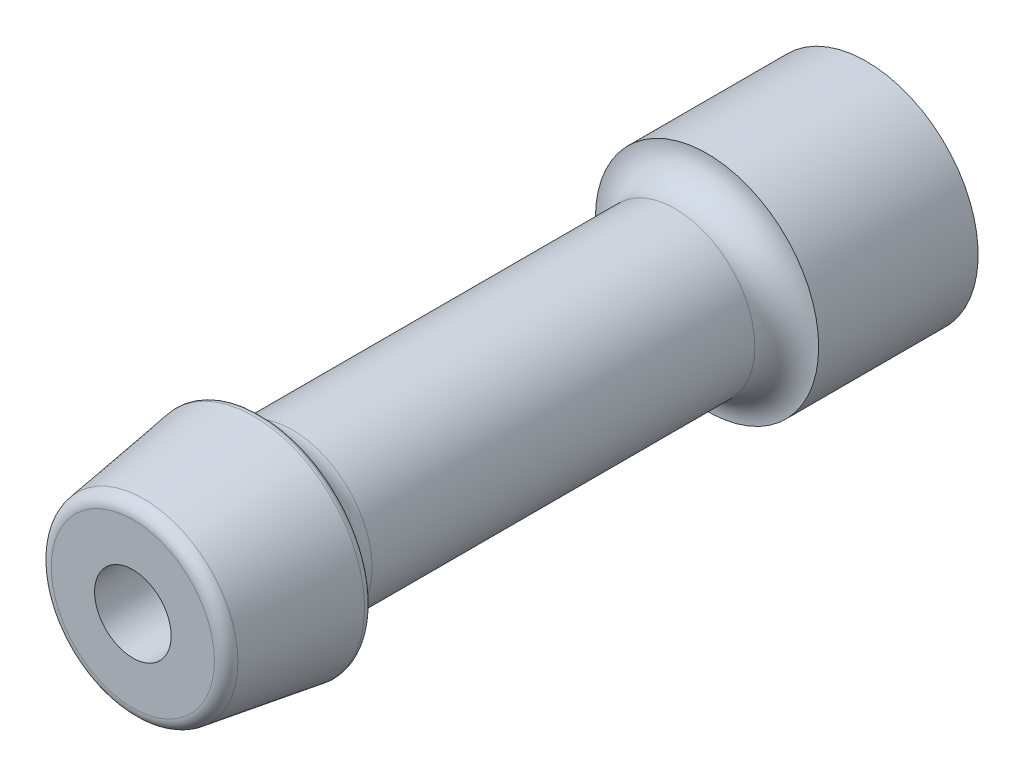
from build123d import *

# Parameters (mm, degrees)
SKETCH1_R           = 4.445
BOSS_EXTRUDE1_DEPTH = 29.21
SKETCH2_R           = 1.524
CUT_EXTRUDE1_START  = -5.08
SKETCH3_R           = 6.35
SKETCH3_R_2         = 3.175
CUT_EXTRUDE1_DEPTH  = 17.78
FILLET1_R           = 1.27
FILLET2_R           = 1.27
CHAMFER1_SIZE       = 5.08
CHAMFER1_SIZE_2     = 0.759211087
FILLET3_R           = 0.254
FILLET4_R           = 0.508


# Some blends are built 0.0001 mm under size
with BuildPart() as part:
    # Sketch1 → Boss-Extrude1 (new body)
    with BuildSketch(Plane.XY):
        with Locations(Location((0, 0, 0), (0, 0, 180))):
            Circle(SKETCH1_R)
    extrude(amount=BOSS_EXTRUDE1_DEPTH)

    # Cut-Sweep1: sweep along a curve in space
    with BuildLine() as cut_sweep1_path:
        Line((0, 0, 29.21), (0, 0, 0))
    # Sketch2 → Cut-Sweep1 (sweep, cut)
    with BuildSketch(Plane.XY.offset(29.21)):
        Circle(SKETCH2_R)
    sweep(path=cut_sweep1_path.line, mode=Mode.SUBTRACT)

    # Sketch3 → Cut-Extrude1 (cut)
    with BuildSketch(Plane.XY.offset(29.21).offset(CUT_EXTRUDE1_START)):
        Circle(SKETCH3_R)
        Circle(SKETCH3_R_2, mode=Mode.SUBTRACT)
    extrude(amount=-CUT_EXTRUDE1_DEPTH, mode=Mode.SUBTRACT)

    # Fillet1
    fillet1_edges = [part.edges().sort_by_distance(p)[0] for p in [
        (-3.175, 0, 6.35),
    ]]
    fillet(fillet1_edges, radius=FILLET1_R - 0.0001)  # a hair under: the kernel refuses the full size

    # Fillet2
    fillet2_edges = [part.edges().sort_by_distance(p)[0] for p in [
        (-3.175, 0, 24.13),
    ]]
    fillet(fillet2_edges, radius=FILLET2_R - 0.0001)  # a hair under: the kernel refuses the full size

    # Chamfer1
    # the kernel refuses this chamfer: 5.08, 0.759211087 mm, written as the material it takes off along each edge
    with BuildSketch(Plane(origin=(0, 0, 29.21), x_dir=(-1, 0, 0), z_dir=(0, 1, 0))) as chamfer1_piece_1:
        Polygon((4.445, -CHAMFER1_SIZE), (4.445 - CHAMFER1_SIZE_2, 0), (4.445, 0), align=None)
    revolve(axis=Axis((0, 0, 29.21), (0, 0, 1)), mode=Mode.SUBTRACT)

    # Fillet3
    fillet3_edges = [part.edges().sort_by_distance(p)[0] for p in [
        (4.445, 0, 24.13),
    ]]
    fillet(fillet3_edges, radius=FILLET3_R)

    # Fillet4
    fillet4_edges = [part.edges().sort_by_distance(p)[0] for p in [
        (3.685788913, 0, 29.21),
    ]]
    fillet(fillet4_edges, radius=FILLET4_R)


solid = part.part
